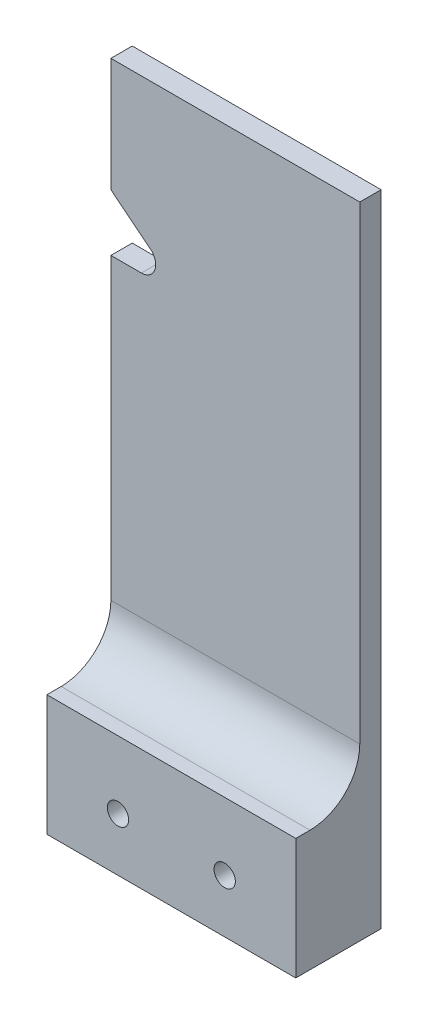
from build123d import *

# Parameters (mm, degrees)
SKETCH_1_W          = 35
SKETCH_1_H          = 90
EXTRUDE_1_DEPTH     = 3
SKETCH_2_W          = 35
SKETCH_2_H          = 17
EXTRUDE_2_DEPTH     = 9
FILLET_1_R          = 7
SKETCH_3_R          = 1.5
CUT_EXTRUDE_3_DEPTH = 50.751884386
CUT_EXTRUDE_4_DEPTH = 50.751884386
FILLET_2_R          = 2


with BuildPart() as part:
    # 草图1 → 凸台-拉伸1 (new body)
    with BuildSketch(Plane.XY):
        Rectangle(SKETCH_1_W, SKETCH_1_H)
    extrude(amount=EXTRUDE_1_DEPTH)

    # 草图2 → 凸台-拉伸2 (add)
    with BuildSketch(Plane.XY.offset(3)):
        with Locations((0, -36.5)):
            Rectangle(SKETCH_2_W, SKETCH_2_H)
    extrude(amount=EXTRUDE_2_DEPTH)

    # 圆角1
    fillet_1_edges = [part.edges().sort_by_distance(p)[0] for p in [
        (0, -28, 3),
    ]]
    fillet(fillet_1_edges, radius=FILLET_1_R)

    # 草图3 → 切除-拉伸3 (cut, through all)
    with BuildSketch(Plane.XY.offset(12)):
        with Locations((-7.5, -37.5)):
            Circle(SKETCH_3_R)
        with Locations((7.5, -37.5)):
            Circle(SKETCH_3_R)
    extrude(amount=-CUT_EXTRUDE_3_DEPTH, mode=Mode.SUBTRACT)

    # 草图4 → 切除-拉伸4 (cut, through all)
    with BuildSketch(Plane(origin=(0, 0, 0), x_dir=(-1, 0, 0), z_dir=(0, 0, -1))):
        Polygon((17.5, 21), (7.5, 21), (17.5, 29), align=None)
    extrude(amount=-CUT_EXTRUDE_4_DEPTH, mode=Mode.SUBTRACT)

    # 圆角2
    fillet_2_edges = [part.edges().sort_by_distance(p)[0] for p in [
        (-7.5, 21, 1.5),
    ]]
    fillet(fillet_2_edges, radius=FILLET_2_R)


solid = part.part
